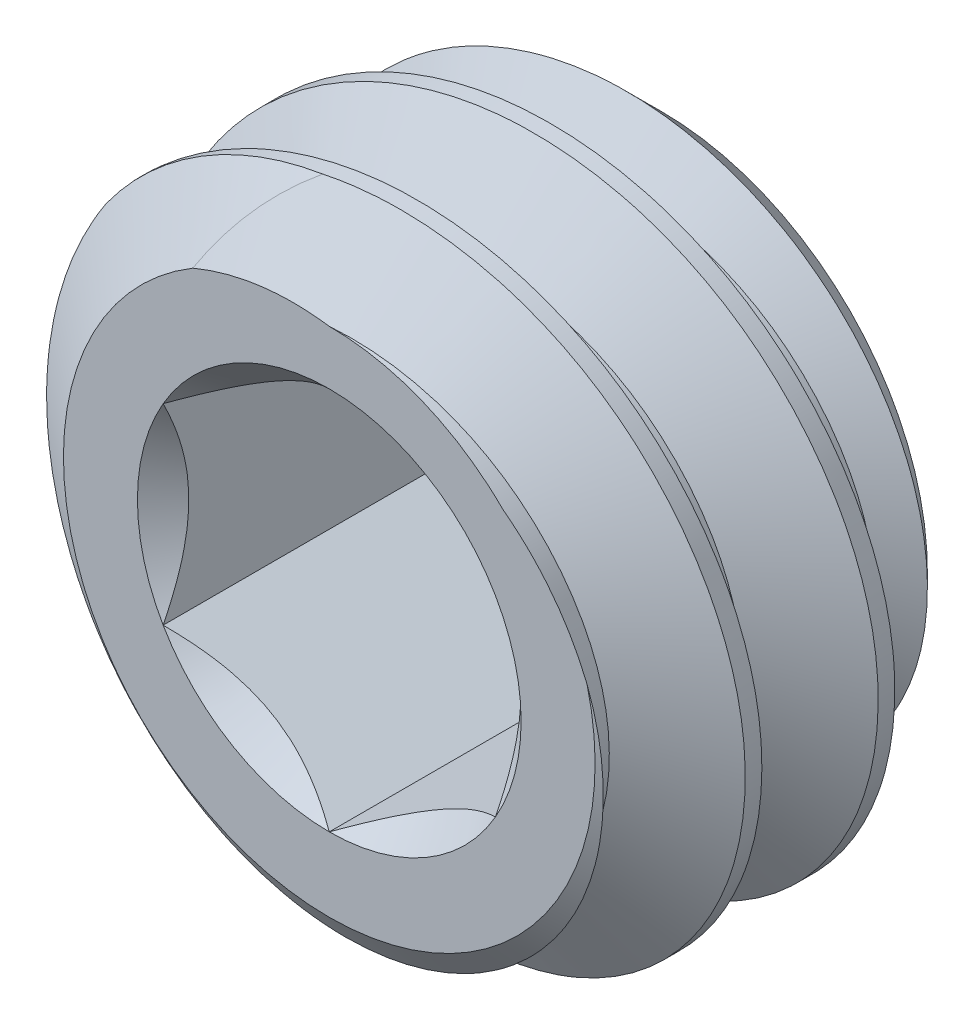
from build123d import *

# Parameters (mm, degrees)
CUT_SWEEP2_PITCH    = 1.27
CUT_EXTRUDE10_DEPTH = 6.499261487


with BuildPart() as part:
    # Sketch22 → Revolve1 (revolve)
    with BuildSketch(Plane(origin=(0, 0, 0), x_dir=(0, 0, -1), z_dir=(1, 0, 0)), mode=Mode.PRIVATE) as revolve1_sk:
        Polygon((-1.5875, 0), (-1.5875, 2.54), (-1.142868213, 3.175), (0.9525, 3.175), (1.5875, 2.54), (1.5875, 0), (0, 0), align=None)
    revolve(revolve1_sk.sketch.rotate(Axis((0, 0, 0), (0, 0, -1)), 180), axis=Axis((0, 0, 0), (0, 0, -1)))

    # Cut-Sweep2: the profile of Sketch28 profile screwed along a right-hand helix of 3.5 turns, 8 arcs to a turn; built about Z, then put on its axis
    cut_sweep2_z = Axis((0, 0, 0), (0, 0, 1))
    cut_sweep2_corners = [(3.1753, 0, 0.000173205), (3.1753, 0, -1.111423205), (2.350110803, 0, -0.635), (2.350110803, 0, -0.47625)]
    with BuildLine(mode=Mode.PRIVATE) as cut_sweep2_profile:
        Line(cut_sweep2_corners[0], cut_sweep2_corners[1])
        Line(cut_sweep2_corners[1], cut_sweep2_corners[2])
        Line(cut_sweep2_corners[2], cut_sweep2_corners[3])
        Line(cut_sweep2_corners[3], cut_sweep2_corners[0])
    cut_sweep2_cap = Face(cut_sweep2_profile.wire())
    cut_sweep2_turn_angles = [0, 22.5, 45, 67.5, 90, 112.5, 135, 157.5, 180, 202.5, 225, 247.5, 270, 292.5, 315, 337.5, 360]
    cut_sweep2_turn_weights = [1, 0.9238795325112867, 1, 0.9238795325112867, 1, 0.9238795325112867, 1, 0.9238795325112867, 1, 0.9238795325112867, 1, 0.9238795325112867, 1, 0.9238795325112867, 1, 0.9238795325112867, 1]
    cut_sweep2_turn_rails = [Edge.make_bspline([Vector(p[0], p[1], 0).rotate(cut_sweep2_z, cut_sweep2_turn_angles[k]) / cut_sweep2_turn_weights[k] + Vector(0, 0, p[2] + CUT_SWEEP2_PITCH * cut_sweep2_turn_angles[k] / 360) for k in range(17)], [0, 0, 0, 1, 1, 2, 2, 3, 3, 4, 4, 5, 5, 6, 6, 7, 7, 8, 8, 8], 2, cut_sweep2_turn_weights) for p in cut_sweep2_corners]
    cut_sweep2_turn_sides = [Face.make_surface_from_curves(cut_sweep2_turn_rails[p[0]], cut_sweep2_turn_rails[p[1]]) for p in [(0, 1), (1, 2), (2, 3), (3, 0)]]
    cut_sweep2_last_angles = [1080, 1102.5, 1125, 1147.5, 1170, 1192.5, 1215, 1237.5, 1260]
    cut_sweep2_last_weights = [1, 0.9238795325112867, 1, 0.9238795325112867, 1, 0.9238795325112867, 1, 0.9238795325112769, 1]
    cut_sweep2_last_rails = [Edge.make_bspline([Vector(p[0], p[1], 0).rotate(cut_sweep2_z, cut_sweep2_last_angles[k]) / cut_sweep2_last_weights[k] + Vector(0, 0, p[2] + CUT_SWEEP2_PITCH * cut_sweep2_last_angles[k] / 360) for k in range(9)], [0, 0, 0, 1, 1, 2, 2, 3, 3, 4, 4, 4], 2, cut_sweep2_last_weights) for p in cut_sweep2_corners]
    cut_sweep2_last_sides = [Face.make_surface_from_curves(cut_sweep2_last_rails[p[0]], cut_sweep2_last_rails[p[1]]) for p in [(0, 1), (1, 2), (2, 3), (3, 0)]]
    cut_sweep2 = Plane(origin=(0, 0, -1.5875), x_dir=(0, 1, 0), z_dir=(0, 0, 1)) * Solid(Shell([*[p.moved(Location((0, 0, CUT_SWEEP2_PITCH * i))) for i in range(3) for p in cut_sweep2_turn_sides], *cut_sweep2_last_sides, cut_sweep2_cap, cut_sweep2_cap.rotate(cut_sweep2_z, 1260).moved(Location((0, 0, CUT_SWEEP2_PITCH * 1260 / 360)))]))
    add(cut_sweep2, mode=Mode.SUBTRACT)

    # Sketch23 → Cut-Extrude10 (cut, through all)
    with BuildSketch(Plane.XY.offset(1.5875)):
        Polygon((0, 1.833087105), (-1.5875, 0.916543552), (-1.5875, -0.916543552), (0, -1.833087105), (1.5875, -0.916543552), (1.5875, 0.916543552), align=None)
    extrude(amount=-CUT_EXTRUDE10_DEPTH, mode=Mode.SUBTRACT)

    # Cut-Extrude11 cone 1 section (through the dimple's axis) → Cut-Extrude11 (revolve, cut)
    with BuildSketch(Plane(origin=(0, 0, 1.5875), x_dir=(0, -1, 0), z_dir=(1, 0, 0))):
        Polygon((0, 0), (1.833087105, 0), (0, 1.833087105), align=None)
    revolve(axis=Axis((0, 0, 1.5875), (0, 0, -1)), mode=Mode.SUBTRACT)


solid = part.part
